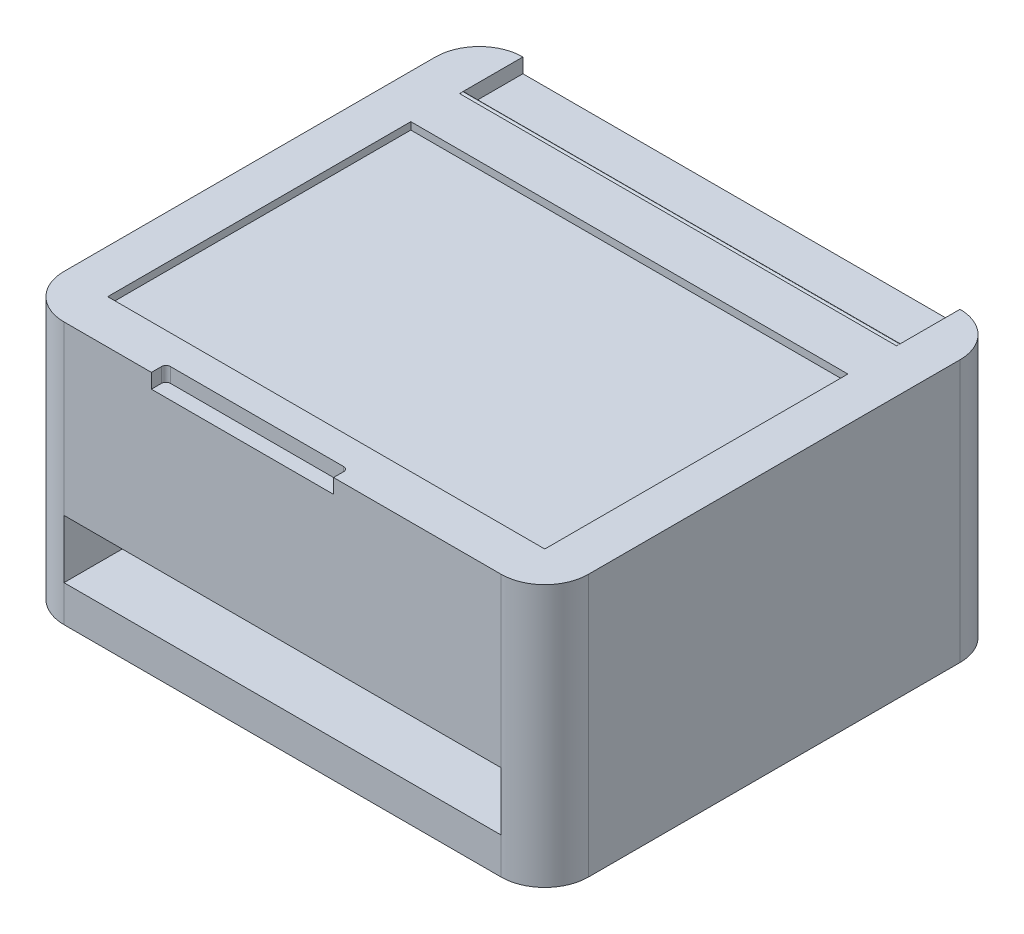
from build123d import *

# Parameters (mm, degrees)
SKETCH1_W           = 360
SKETCH1_H           = 315
BASE_FLANGE1_DEPTH  = 180
FILLET1_R           = 30
SKETCH6_W           = 300
SKETCH6_H           = 40
CUT_EXTRUDE1_DEPTH  = 10
CUT_EXTRUDE2_DEPTH  = 10
SKETCH16_W          = 300
SKETCH16_H          = 3.52
CUT_EXTRUDE3_DEPTH  = 3.52
SKETCH17_R          = 1.76
BOSS_EXTRUDE3_DEPTH = 300
SKETCH18_W          = 300
SKETCH18_H          = 40
CUT_EXTRUDE4_DEPTH  = 150
SKETCH22_W          = 300
SKETCH22_H          = 208.048205441
CUT_EXTRUDE6_DEPTH  = 5


# Sheet-metal steps are written as plain solids
with BuildPart() as part:
    # Sketch1 → Base-Flange1 (new body)
    with BuildSketch(Plane(origin=(0, 0, 0), x_dir=(1, 0, 0), z_dir=(0, 1, 0))):
        Rectangle(SKETCH1_W, SKETCH1_H)
    extrude(amount=-BASE_FLANGE1_DEPTH)

    # Fillet1
    fillet1_edges = [part.edges().sort_by_distance(p)[0] for p in [
        (-180, -90, -157.5),
        (180, -90, -157.5),
        (180, -90, 157.5),
        (-180, -90, 157.5),
    ]]
    fillet(fillet1_edges, radius=FILLET1_R)

    # Sketch6 → Cut-Extrude1 (cut)
    with BuildSketch(Plane(origin=(0, 0, 0), x_dir=(1, 0, 0), z_dir=(0, 1, 0))):
        with Locations((0, 137.5)):
            Rectangle(SKETCH6_W, SKETCH6_H)
    extrude(amount=-CUT_EXTRUDE1_DEPTH, mode=Mode.SUBTRACT)

    # Sketch7 → Cut-Extrude2 (cut)
    with BuildSketch(Plane(origin=(0, 0, 0), x_dir=(1, 0, 0), z_dir=(0, 1, 0))):
        with BuildLine():
            Line((-90, -157.5), (-90, -150.5))
            ThreePointArc((-90, -150.5), (-89.121320344, -148.378679656), (-87, -147.5))
            Line((-87, -147.5), (32, -147.5))
            ThreePointArc((32, -147.5), (34.121320344, -148.378679656), (35, -150.5))
            Line((35, -150.5), (35, -157.5))
            Line((35, -157.5), (-90, -157.5))
        make_face()
    extrude(amount=-CUT_EXTRUDE2_DEPTH, mode=Mode.SUBTRACT)

    # Sketch16 → Cut-Extrude3 (cut)
    with BuildSketch(Plane(origin=(0, 0, 0), x_dir=(1, 0, 0), z_dir=(0, 1, 0))):
        with Locations((0, 115.74)):
            Rectangle(SKETCH16_W, SKETCH16_H)
    extrude(amount=-CUT_EXTRUDE3_DEPTH, mode=Mode.SUBTRACT)

    # Sketch18 → Cut-Extrude4 (cut)
    with BuildSketch(Plane.XY.offset(157.5)):
        with Locations((0, -135)):
            Rectangle(SKETCH18_W, SKETCH18_H)
    extrude(amount=-CUT_EXTRUDE4_DEPTH, mode=Mode.SUBTRACT)

    # Sketch22 → Cut-Extrude6 (cut)
    with BuildSketch(Plane(origin=(0, 0, 0), x_dir=(1, 0, 0), z_dir=(0, 1, 0))):
        with Locations((0, -23.47589728)):
            Rectangle(SKETCH22_W, SKETCH22_H)
    extrude(amount=-CUT_EXTRUDE6_DEPTH, mode=Mode.SUBTRACT)


with BuildPart() as body_2:
    # Sketch17 → Boss-Extrude3 (new body)
    with BuildSketch(Plane(origin=(-150, 0, 0), x_dir=(0, 0, -1), z_dir=(1, 0, 0))):
        with Locations((115.74, -1.76)):
            Circle(SKETCH17_R)
    extrude(amount=BOSS_EXTRUDE3_DEPTH)


solid = Compound([part.part, body_2.part])
